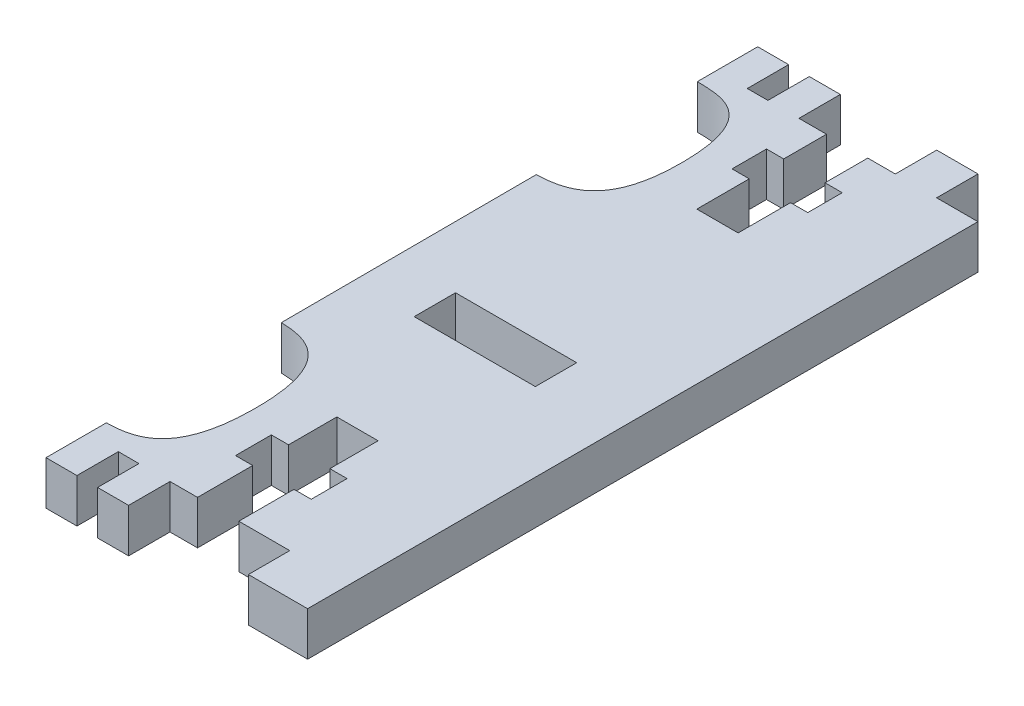
from build123d import *

# Parameters (mm, degrees)
SKETCH1_W           = 8.784371834
SKETCH1_H           = 3.000075643
BOSS_EXTRUDE1_DEPTH = 3.175


with BuildPart() as part:
    # Sketch1 → Boss-Extrude1 (new body)
    with BuildSketch(Plane(origin=(0, 0, 0), x_dir=(1, 0, 0), z_dir=(0, 1, 0))):
        with BuildLine():
            add(Edge.make_bspline(
                [(-4.995070997, -15.262909799), (-5.024784848, -20.882307214), (-7.42654728, -21.443818214), (-9.483120155, -21.470892841)],
                knots=[2, 2, 2, 2, 3, 3, 3, 3], degree=3))
            Line((-9.483120155, -21.470892841), (-9.483120155, -25.850971148))
            Line((-9.483120155, -25.850971148), (-7.240182549, -25.850971148))
            Line((-7.240182549, -25.850971148), (-7.240182549, -22.850827141))
            Line((-7.240182549, -22.850827141), (-5.742820851, -22.850827141))
            Line((-5.742820851, -22.850827141), (-5.742820851, -25.850971148))
            Line((-5.742820851, -25.850971148), (-3.493751351, -25.850971148))
            Line((-3.493751351, -25.850971148), (-3.493751351, -22.850827141))
            Line((-3.493751351, -22.850827141), (-1.497298333, -22.850827141))
            Line((-1.497298333, -22.850827141), (-1.497298333, -18.850679894))
            Line((-1.497298333, -18.850679894), (-2.745036382, -18.850679894))
            Line((-2.745036382, -18.850679894), (-2.745036382, -18.750702276))
            Line((-2.745036382, -18.750702276), (-2.745036382, -16.250563552))
            Line((-2.745036382, -16.250563552), (-1.497298333, -16.250563552))
            Line((-1.497298333, -16.250563552), (-1.497298333, -12.750414262))
            Line((-1.497298333, -12.750414262), (1.49723009, -12.750414262))
            Line((1.49723009, -12.750414262), (1.49723009, -16.250563552))
            Line((1.49723009, -16.250563552), (2.745046129, -16.250563552))
            Line((2.745046129, -16.250563552), (2.745046129, -18.750702276))
            Line((2.745046129, -18.750702276), (2.745046129, -18.850679894))
            Line((2.745046129, -18.850679894), (1.49723009, -18.850679894))
            Line((1.49723009, -18.850679894), (1.49723009, -22.850827141))
            Line((1.49723009, -22.850827141), (5.190823665, -22.850827141))
            Line((5.190823665, -22.850827141), (5.190823665, -25.850971148))
            Line((5.190823665, -25.850971148), (9.483120155, -25.850971148))
            Line((9.483120155, -25.850971148), (9.483120155, 22.750856849))
            Line((9.483120155, 22.750856849), (6.488406507, 22.750856849))
            Line((6.488406507, 22.750856849), (6.488406507, 25.750995973))
            Line((6.488406507, 25.750995973), (3.49369286, 25.750995973))
            Line((3.49369286, 25.750995973), (3.49369286, 22.750856849))
            Line((3.49369286, 22.750856849), (1.497230093, 22.750856849))
            Line((1.497230093, 22.750856849), (1.497230093, 19.650735225))
            Line((1.497230093, 19.650735225), (2.745046131, 19.650735225))
            Line((2.745046131, 19.650735225), (2.745046131, 17.150659981))
            Line((2.745046131, 17.150659981), (1.497230093, 17.150659981))
            Line((1.497230093, 17.150659981), (1.497230093, 13.350397163))
            Line((1.497230093, 13.350397163), (-1.497298331, 13.350397163))
            Line((-1.497298331, 13.350397163), (-1.497298331, 17.150659981))
            Line((-1.497298331, 17.150659981), (-2.74503638, 17.150659981))
            Line((-2.74503638, 17.150659981), (-2.74503638, 19.650735225))
            Line((-2.74503638, 19.650735225), (-1.497298331, 19.650735225))
            Line((-1.497298331, 19.650735225), (-1.497298331, 22.750856849))
            Line((-1.497298331, 22.750856849), (-3.493751349, 22.750856849))
            Line((-3.493751349, 22.750856849), (-3.493751349, 25.750995973))
            Line((-3.493751349, 25.750995973), (-5.742820849, 25.750995973))
            Line((-5.742820849, 25.750995973), (-5.742820849, 22.750856849))
            Line((-5.742820849, 22.750856849), (-7.240182547, 22.750856849))
            Line((-7.240182547, 22.750856849), (-7.240182547, 25.750995973))
            Line((-7.240182547, 25.750995973), (-9.483120153, 25.750995973))
            Line((-9.483120153, 25.750995973), (-9.483120153, 21.370917666))
            add(Edge.make_bspline(
                [(-4.952518186, 15.886251248), (-5.015201934, 21.274211759), (-7.426547278, 21.343845481), (-9.483120153, 21.370917666)],
                knots=[6, 6, 6, 6, 7, 7, 7, 7], degree=3))
            add(Edge.make_bspline(
                [(-9.483120153, 9.692990904), (-7.240182547, 9.757380123), (-4.889844186, 10.498168659), (-4.952518186, 15.886251248)],
                knots=[5, 5, 5, 5, 6, 6, 6, 6], degree=3))
            Line((-9.483120153, 9.692990904), (-9.431179406, -8.834115587))
            add(Edge.make_bspline(
                [(-9.431179406, -8.834115587), (-7.188183308, -8.898499923), (-4.965366893, -9.64325846), (-4.995070997, -15.262909799)],
                knots=[1, 1, 1, 1, 2, 2, 2, 2], degree=3))
        make_face()
        with Locations((-0.598927132, -2.150035167)):
            Rectangle(SKETCH1_W, SKETCH1_H, mode=Mode.SUBTRACT)
    extrude(amount=BOSS_EXTRUDE1_DEPTH)


solid = part.part
